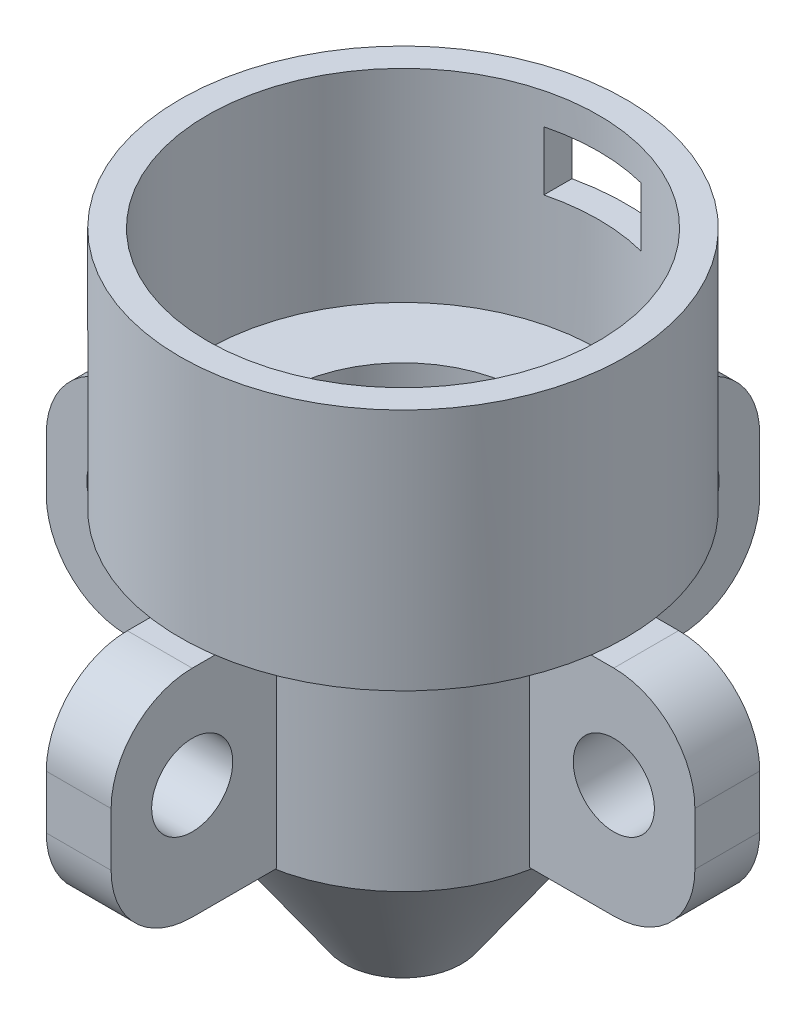
from build123d import *

# Parameters (mm, degrees)
SKETCH_1_R               = 55
EXTRUDE_1_DEPTH          = 150
SKETCH_2_R               = 30
CUT_EXTRUDE_1_DEPTH      = 100
SKETCH_3_R               = 48.25
CUT_EXTRUDE_2_DEPTH      = 50
SKETCH_4_R               = 60
SKETCH_4_R_2             = 40
CUT_EXTRUDE_1_2_DEPTH    = 90
EXTRUDE_START            = 30
SKETCH_6_W               = 16
SKETCH_6_H               = 53.194792051
EXTRUDE_3_DEPTH          = 50
EXTRUDE_START_2          = -30
SKETCH_10_W              = 16
SKETCH_10_H              = 53.194792051
EXTRUDE_4_DEPTH          = 50
SKETCH_11_W              = 16
SKETCH_11_H              = 53
EXTRUDE_6_DEPTH          = 50
SKETCH_12_W              = 16
SKETCH_12_H              = 53
EXTRUDE_7_DEPTH          = 50
FILLET_1_R               = 20
FILLET_2_R               = 20
FILLET_3_R               = 20
FILLET_4_R               = 20
CUT_EXTRUDE_4_DEPTH      = 40
CUT_EXTRUDE_4_DEPTH_BACK = 40
SKETCH_15_R              = 10
CUT_EXTRUDE_5_DEPTH      = 40
CUT_EXTRUDE_5_DEPTH_BACK = 40
SKETCH_16_R              = 10
SKETCH_17_W              = 24
SKETCH_17_H              = 14.571737585
CUT_EXTRUDE_6_DEPTH      = 87
SKETCH_18_R              = 34
SKETCH_18_R_2            = 14
EXTRUDE_1_2_DEPTH        = 47


with BuildPart() as part:
    # 草图1 → Extrude 1 (new body)
    with BuildSketch(Plane(origin=(0, 0, 0), x_dir=(1, 0, 0), z_dir=(0, 1, 0))):
        with Locations(Location((0, 0, 0), (0, 0, 270))):
            Circle(SKETCH_1_R)
    extrude(amount=EXTRUDE_1_DEPTH)

    # 草图2 → Cut-Extrude 1 (cut)
    with BuildSketch(Plane.XZ):
        with Locations(Location((0, 0, 0), (0, 0, 270))):
            Circle(SKETCH_2_R)
    extrude(amount=-CUT_EXTRUDE_1_DEPTH, mode=Mode.SUBTRACT)

    # 草图3 → 切除-拉伸2 (cut)
    with BuildSketch(Plane(origin=(0, 150, 0), x_dir=(1, 0, 0), z_dir=(0, 1, 0))):
        with Locations(Location((0, 0, 0), (0, 0, 270))):
            Circle(SKETCH_3_R)
    extrude(amount=-CUT_EXTRUDE_2_DEPTH, mode=Mode.SUBTRACT)

    # 草图4 → Cut-Extrude 1 2 (cut)
    with BuildSketch(Plane.XZ):
        Circle(SKETCH_4_R)
        Circle(SKETCH_4_R_2, mode=Mode.SUBTRACT)
    extrude(amount=-CUT_EXTRUDE_1_2_DEPTH, mode=Mode.SUBTRACT)

    # 草图11 → 凸台-拉伸6 (add)
    with BuildSketch(Plane(origin=(0, 0, 0), x_dir=(0, 0, -1), z_dir=(1, 0, 0)).offset(EXTRUDE_START)):
        with Locations((0, 63.5)):
            Rectangle(SKETCH_11_W, SKETCH_11_H)
    extrude(amount=EXTRUDE_6_DEPTH)

    # 草图12 → 凸台-拉伸7 (add)
    with BuildSketch(Plane(origin=(0, 0, 0), x_dir=(0, 0, -1), z_dir=(1, 0, 0)).offset(EXTRUDE_START_2)):
        with Locations((0, 63.5)):
            Rectangle(SKETCH_12_W, SKETCH_12_H)
    extrude(amount=-EXTRUDE_7_DEPTH)

    # 圆角1
    fillet_1_edges = [part.edges().sort_by_distance(p)[0] for p in [
        (-80, 90, 0),
        (-80, 37, 0),
    ]]
    fillet(fillet_1_edges, radius=FILLET_1_R)

    # 圆角3
    fillet_3_edges = [part.edges().sort_by_distance(p)[0] for p in [
        (80, 37, 0),
        (80, 90, 0),
    ]]
    fillet(fillet_3_edges, radius=FILLET_3_R)

    # 草图15 → 切除-拉伸4 (cut, two sides: drawn at the far end of the back side and taken through both)
    with BuildSketch(Plane.XY.offset(-CUT_EXTRUDE_4_DEPTH_BACK)):
        with Locations(Location((60, 65, 0), (0, 0, 180))):
            Circle(SKETCH_15_R)
        with Locations(Location((-60, 65, 0), (0, 0, 180))):
            Circle(SKETCH_15_R)
    extrude(amount=CUT_EXTRUDE_4_DEPTH + CUT_EXTRUDE_4_DEPTH_BACK, mode=Mode.SUBTRACT)

    # 草图17 → 切除-拉伸6 (cut)
    with BuildSketch(Plane.XY):
        with Locations((0, 134.985868793)):
            Rectangle(SKETCH_17_W, SKETCH_17_H)
    extrude(amount=-CUT_EXTRUDE_6_DEPTH, mode=Mode.SUBTRACT)



with BuildPart() as body_2:
    # 草图6 → 凸台-拉伸3 (new body)
    with BuildSketch(Plane.XY.offset(EXTRUDE_START)):
        with Locations((0, 63.37627806)):
            Rectangle(SKETCH_6_W, SKETCH_6_H)
    extrude(amount=EXTRUDE_3_DEPTH)

    # 圆角4
    fillet_4_edges = [body_2.edges().sort_by_distance(p)[0] for p in [
        (0, 36.778882035, 80),
        (0, 89.973674086, 80),
    ]]
    fillet(fillet_4_edges, radius=FILLET_4_R)


with BuildPart() as body_3:
    # 草图10 → 凸台-拉伸4 (new body)
    with BuildSketch(Plane.XY.offset(EXTRUDE_START_2)):
        with Locations((0, 63.37627806)):
            Rectangle(SKETCH_10_W, SKETCH_10_H)
    extrude(amount=-EXTRUDE_4_DEPTH)

    # 圆角2
    fillet_2_edges = [body_3.edges().sort_by_distance(p)[0] for p in [
        (0, 89.973674086, -80),
        (0, 36.778882035, -80),
    ]]
    fillet(fillet_2_edges, radius=FILLET_2_R)


with BuildPart() as cut_extrude_5_tool:
    # 草图16 → 切除-拉伸5 (new, two sides: drawn at the far end of the back side and taken through both)
    with BuildSketch(Plane(origin=(0, 0, 0), x_dir=(0, 0, -1), z_dir=(1, 0, 0)).offset(-CUT_EXTRUDE_5_DEPTH_BACK)):
        with Locations(Location((60, 65, 0), (0, 0, 180))):
            Circle(SKETCH_16_R)
        with Locations(Location((-60, 65, 0), (0, 0, 270))):
            Circle(SKETCH_16_R)
    extrude(amount=CUT_EXTRUDE_5_DEPTH + CUT_EXTRUDE_5_DEPTH_BACK)


with BuildPart() as body_2_1:
    add(body_2.part)

    # 切除-拉伸5: cut by cut_extrude_5_tool
    add(cut_extrude_5_tool.part, mode=Mode.SUBTRACT)


with BuildPart() as body_3_1:
    add(body_3.part)

    # 切除-拉伸5: cut by cut_extrude_5_tool
    add(cut_extrude_5_tool.part, mode=Mode.SUBTRACT)


with BuildPart() as part_1:
    add(part.part)

    add(body_2_1.part)  # Extrude 1 2 merges body 2

    add(body_3_1.part)  # Extrude 1 2 merges body 3
    # 草图18 → Extrude 1 2 (add)
    with BuildSketch(Plane.XZ):
        Circle(SKETCH_18_R)
        Circle(SKETCH_18_R_2, mode=Mode.SUBTRACT)
    extrude(amount=-EXTRUDE_1_2_DEPTH)

    # 倒角1: read off the stored shape, not the designer's step
    # 倒角1 outline → 倒角1 (revolve, cut)
    with BuildSketch(Plane.XY):
        Polygon((40, 36.5), (14.442424855, 0), (40, 0), align=None)
    revolve(axis=Axis((0, 0, 0), (0, 1, 0)), mode=Mode.SUBTRACT)


solid = part_1.part
